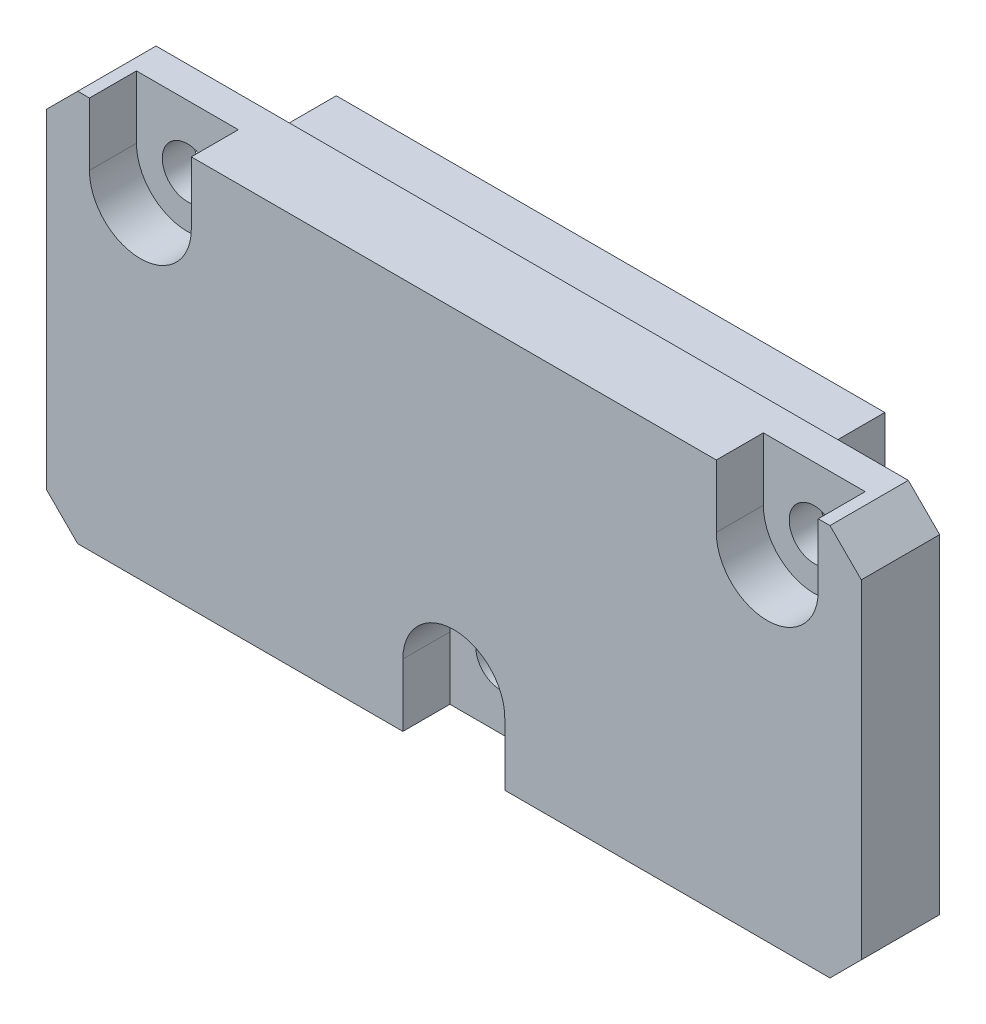
from build123d import *

# Parameters (mm, degrees)
SKETCH_1_W          = 52
SKETCH_1_H          = 25
EXTRUDE_1_DEPTH     = 5
CHAMFER_1_SIZE      = 2
SKETCH_2_W          = 35
SKETCH_2_H          = 15
EXTRUDE_2_DEPTH     = 5
CUT_EXTRUDE_1_DEPTH = 3
SKETCH_5_R          = 1.6
CUT_EXTRUDE_2_DEPTH = 30.685855218


with BuildPart() as part:
    # Эскиз1 → Бобышка-Вытянуть1 (new body)
    with BuildSketch(Plane.XY):
        Rectangle(SKETCH_1_W, SKETCH_1_H)
    extrude(amount=EXTRUDE_1_DEPTH)

    # Фаска1
    chamfer_1_edges = [part.edges().sort_by_distance(p)[0] for p in [
        (26, -12.5, 2.5),
        (-26, -12.5, 2.5),
        (-26, 12.5, 2.5),
        (26, 12.5, 2.5),
    ]]
    chamfer(chamfer_1_edges, length=CHAMFER_1_SIZE)

    # Эскиз2 → Бобышка-Вытянуть2 (add)
    with BuildSketch(Plane(origin=(0, 0, 0), x_dir=(-1, 0, 0), z_dir=(0, 0, -1))):
        with Locations((0, 3)):
            Rectangle(SKETCH_2_W, SKETCH_2_H)
    extrude(amount=EXTRUDE_2_DEPTH)

    # Эскиз3 → Вырез-Вытянуть1 (cut)
    with BuildSketch(Plane.XY.offset(5)):
        with BuildLine():
            Line((3.25, -12.5), (3.25, -8.5))
            ThreePointArc((3.25, -8.5), (0, -5.25), (-3.25, -8.5))
            Line((-3.25, -8.5), (-3.25, -12.5))
            Line((-3.25, -12.5), (3.25, -12.5))
        make_face()
        with BuildLine():
            Line((23.25, 12.5), (16.75, 12.5))
            Line((16.75, 12.5), (16.75, 8.5))
            ThreePointArc((16.75, 8.5), (20, 5.25), (23.25, 8.5))
            Line((23.25, 8.5), (23.25, 12.5))
        make_face()
        with BuildLine():
            Line((-23.25, 12.5), (-23.25, 8.5))
            ThreePointArc((-23.25, 8.5), (-20, 5.25), (-16.75, 8.5))
            Line((-16.75, 8.5), (-16.75, 12.5))
            Line((-16.75, 12.5), (-23.25, 12.5))
        make_face()
    extrude(amount=-CUT_EXTRUDE_1_DEPTH, mode=Mode.SUBTRACT)

    # Эскиз5 → Вырез-Вытянуть2 (cut, through all)
    with BuildSketch(Plane.XY.offset(2)):
        with Locations((0, -8.5)):
            Circle(SKETCH_5_R)
        with Locations((-20, 8.5)):
            Circle(SKETCH_5_R)
        with Locations((20, 8.5)):
            Circle(SKETCH_5_R)
    extrude(amount=-CUT_EXTRUDE_2_DEPTH, mode=Mode.SUBTRACT)


solid = part.part
